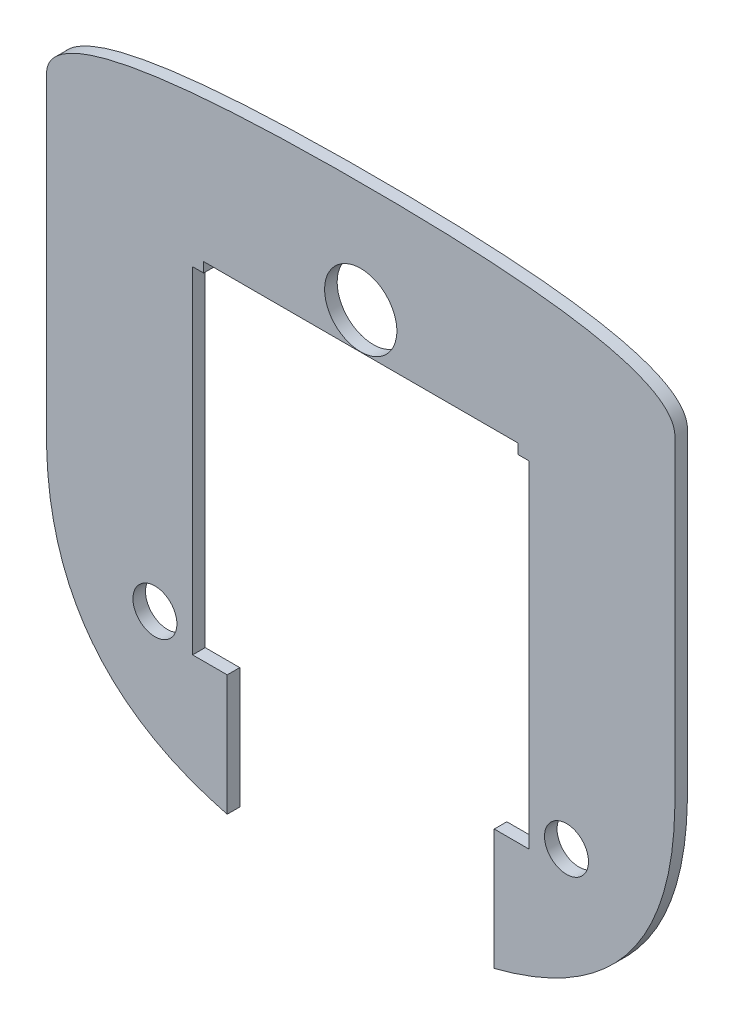
from build123d import *

# Parameters (mm, degrees)
SKETCH1_R           = 7
SKETCH1_R_2         = 11.5
BOSS_EXTRUDE1_DEPTH = 4


with BuildPart() as part:
    # Sketch1 → Boss-Extrude1 (new body)
    with BuildSketch(Plane(origin=(0, 0, 650), x_dir=(-1, 0, 0), z_dir=(0, 0, -1))):
        with BuildLine():
            Line((-42.5, -36.887752409), (-53.5, -36.887752409))
            Line((-53.5, -36.887752409), (-53.5, 70.112247591))
            Line((-53.5, 70.112247591), (-50, 70.112247591))
            Line((-50, 70.112247591), (-50, 73.287247591))
            Line((-50, 73.287247591), (50, 73.287247591))
            Line((50, 73.287247591), (50, 70.112247591))
            Line((50, 70.112247591), (53.5, 70.112247591))
            Line((53.5, 70.112247591), (53.5, -36.887752409))
            Line((53.5, -36.887752409), (42.5, -36.887752409))
            Line((42.5, -36.887752409), (42.5, -75.326207246))
            add(Edge.make_bspline(
                [(-100, 99.999977317), (-100, 100.554133984), (-99.883481571, 101.662960322), (-99.344039294, 103.24640831), (-98.497409778, 104.684675491), (-97.062216748, 106.38426363), (-94.888769283, 108.125797157), (-91.997605564, 109.778159516), (-88.955076104, 111.127119387), (-85.826207347, 112.255213282), (-82.642454957, 113.216882388), (-79.422724525, 114.047932887), (-76.177738988, 114.773887656), (-72.914698058, 115.412911055), (-69.638266917, 115.97899226), (-65.256098304, 116.65012584), (-59.759108699, 117.35435974), (-53.14371303, 118.031992988), (-46.516062932, 118.575061909), (-37.668282191, 119.150076755), (-26.595456571, 119.635916555), (-13.299239269, 119.941405287), (-4.433071045, 120), (4.433071252, 120), (13.299239569, 119.941405284), (26.595457014, 119.635916541), (37.668282553, 119.150076735), (46.516063231, 118.575061887), (53.143713246, 118.031992967), (59.75910884, 117.354359724), (65.256098376, 116.650125829), (69.638266941, 115.978992256), (72.914698049, 115.412911057), (76.177738949, 114.773887664), (79.422724461, 114.047932902), (82.642454874, 113.216882411), (85.826207251, 112.255213314), (88.955076005, 111.127119426), (91.997605468, 109.778159564), (94.888769203, 108.12579721), (97.062216691, 106.384263686), (98.497409744, 104.68467554), (99.344039277, 103.246408352), (99.883481568, 101.662960341), (100, 100.554133999), (100, 91.666668304), (100, 75.00000327), (100, 50.000002643), (100, 25.000000796), (100, 8.333333322), (100, -3.050935369), (99.78232424, -9.153462756), (98.681398999, -18.249623011), (96.67077861, -27.1928131), (93.617740139, -35.841010507), (89.426142861, -44.003661602), (84.079370364, -51.464791939), (77.672911561, -58.036890155), (70.388363316, -63.61609759), (62.44855633, -68.199662094), (53.153405893, -72.24290331), (46.39340636, -74.333836019), (42.5, -75.326207246)],
                knots=[0, 0, 0, 0, 0.002355824, 0.004711648, 0.007067472, 0.009423297, 0.014134945, 0.018846593, 0.023558241, 0.02826989, 0.032981538, 0.037693186, 0.042404834, 0.047116483, 0.051828131, 0.056539779, 0.065963076, 0.075386372, 0.084809669, 0.094232965, 0.113079558, 0.131926151, 0.150772744, 0.150772744, 0.169619384, 0.188466024, 0.207312664, 0.216735984, 0.226159304, 0.235582624, 0.245005944, 0.249717604, 0.254429264, 0.259140924, 0.263852584, 0.268564244, 0.273275904, 0.277987564, 0.282699224, 0.287410884, 0.292122544, 0.294478375, 0.296834205, 0.299190035, 0.301545865, 0.301545865, 0.336972328, 0.372398791, 0.407825254, 0.443251717, 0.443251717, 0.456221785, 0.469191854, 0.482161922, 0.49513199, 0.508102059, 0.521072127, 0.534042195, 0.547012264, 0.559982332, 0.5729524, 0.590030402, 0.590030402, 0.590030402, 0.590030402], degree=3))
            add(Edge.make_bspline(
                [(-42.5, -75.326207247), (-46.393406184, -74.333836064), (-53.153405563, -72.242903417), (-62.448555931, -68.1996623), (-70.388363002, -63.6160978), (-77.672911349, -58.036890349), (-84.079370238, -51.464792096), (-89.426142803, -44.003661704), (-93.617740122, -35.841010555), (-96.670778612, -27.192813091), (-98.681399005, -18.249622988), (-99.782324242, -9.153462702), (-100, -3.05093539), (-100, 8.333333413), (-100, 25.000000922), (-100, 50.000002586), (-100, 75.000003054), (-100, 91.666668172), (-100, 99.999977317)],
                knots=[0.711515291, 0.711515291, 0.711515291, 0.711515291, 0.728593312, 0.741563395, 0.754533479, 0.767503562, 0.780473646, 0.79344373, 0.806413813, 0.819383897, 0.83235398, 0.845324064, 0.858294148, 0.858294148, 0.893720611, 0.929147074, 0.964573537, 1, 1, 1, 1], degree=3))
            Line((-42.5, -75.326207247), (-42.5, -36.887752409))
        make_face()
        with Locations((-65.5, -30.887752409)):
            Circle(SKETCH1_R, mode=Mode.SUBTRACT)
        with Locations((65.5, -30.887752409)):
            Circle(SKETCH1_R, mode=Mode.SUBTRACT)
        with Locations((0, 84.887247591)):
            Circle(SKETCH1_R_2, mode=Mode.SUBTRACT)
    extrude(amount=-BOSS_EXTRUDE1_DEPTH)


solid = part.part
